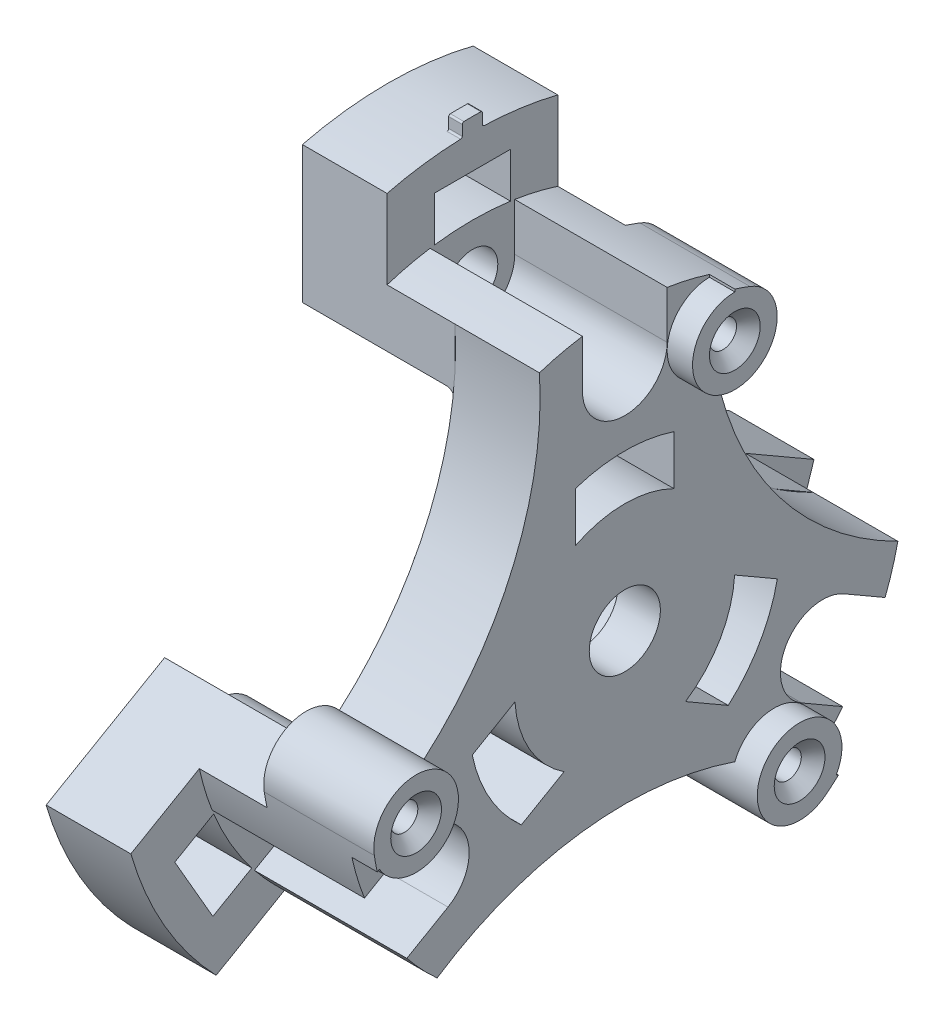
from build123d import *
from build123d.topology import SkipClean

# Parameters (mm, degrees)
SKETCH_2_R                           = 20
CUT_EXTRUDE_1_DEPTH                  = 10
PATTERN_CIRCULAR_1_COUNT             = 3
CUT_EXTRUDE_START                    = -10
CUT_EXTRUDE_2_DEPTH                  = 10
PATTERN_CIRCULAR_2_COUNT             = 3
SKETCH_4_R                           = 1.5
EXTRUDE_1_DEPTH                      = 9
PATTERN_CIRCULAR_3_COUNT             = 3
SKETCH_5_W                           = 6.1
SKETCH_5_H                           = 4.709181557
CUT_EXTRUDE_3_DEPTH                  = 1.5
CUT_EXTRUDE_3_DRAFT                  = -1
PATTERN_CIRCULAR_4_COPY_1_SKETCH_W   = 6.1
PATTERN_CIRCULAR_4_COPY_1_SKETCH_H   = 4.709181557
PATTERN_CIRCULAR_4_COPY_1_DEPTH      = 1.5
PATTERN_CIRCULAR_4_COPY_1_DRAFT      = -1
PATTERN_CIRCULAR_4_COPY_2_SKETCH_W   = 6.1
PATTERN_CIRCULAR_4_COPY_2_SKETCH_H   = 4.709181557
PATTERN_CIRCULAR_4_COPY_2_DEPTH      = 1.5
PATTERN_CIRCULAR_4_COPY_2_DRAFT      = -1
CUT_EXTRUDE_4_DEPTH                  = 9
PATTERN_CIRCULAR_5_COUNT             = 3
EXTRUDE_START                        = -6.5
EXTRUDE_2_DEPTH                      = 6.5
SKETCH_9_R                           = 0.8
CUT_EXTRUDE_7_DEPTH                  = 6.4
CHAMFER_3_SIZE                       = 0.7
PATTERN_CIRCULAR_8_COUNT             = 3
CHAMFER_3_OF_PATTERN_CIRCULAR_8_SIZE = 0.7
CHAMFER_4_SIZE                       = 0.3
FILLET_5_R                           = 0.2
FILLET_6_R                           = 0.5
FILLET_7_R                           = 0.5
EXTRUDE_START_2                      = -5
EXTRUDE_3_DEPTH                      = 5
PATTERN_CIRCULAR_9_COUNT             = 3
EXTRUDE_4_DEPTH                      = 0.8
FILLET_8_R                           = 0.1


with BuildPart() as part:
    # 草图1 → 旋转1 (revolve)
    with BuildSketch(Plane.XY, mode=Mode.PRIVATE) as revolve_1_sk:
        Polygon((-7, 6.5), (-5, 6.5), (-5, 16.5), (0, 16.5), (0, 2.1), (-2.5, 2.1), (-2.5, 4), (-7, 4), align=None)
    revolve(revolve_1_sk.sketch.rotate(Axis((-65.742857143, 0, 0), (1, 0, 0)), 90), axis=Axis((-65.742857143, 0, 0), (1, 0, 0)))

    # 草图2 → 切除-拉伸1 (cut)
    with BuildSketch(Plane.ZY.offset(5)):
        with Locations((-25, 14.43375673)):
            Circle(SKETCH_2_R)
    cut_extrude_1 = extrude(amount=-CUT_EXTRUDE_1_DEPTH, mode=Mode.SUBTRACT)

    # 阵列(圆周)1: 切除-拉伸1 ×3 about axis
    pattern_circular_1_axis = Axis((0, 0, 0), (1, 0, 0))
    for i in range(1, PATTERN_CIRCULAR_1_COUNT):
        add(cut_extrude_1.rotate(pattern_circular_1_axis, i * 360 / PATTERN_CIRCULAR_1_COUNT), mode=Mode.SUBTRACT)

    # 草图3 → 切除-拉伸2 (cut)
    with BuildSketch(Plane.ZY.offset(5).offset(CUT_EXTRUDE_START)):
        with BuildLine():
            Line((-2.9, 8.730979327), (-2.9, 5.817215829))
            ThreePointArc((-2.9, 5.817215829), (0, 6.5), (2.9, 5.817215829))
            Line((2.9, 5.817215829), (2.9, 8.730979327))
            ThreePointArc((2.9, 8.730979327), (0, 9.2), (-2.9, 8.730979327))
        make_face()
    cut_extrude_2 = extrude(amount=CUT_EXTRUDE_2_DEPTH, mode=Mode.SUBTRACT)

    # 阵列(圆周)2: 切除-拉伸2 ×3 about axis
    pattern_circular_2_axis = Axis((0, 0, 0), (1, 0, 0))
    for i in range(1, PATTERN_CIRCULAR_2_COUNT):
        add(cut_extrude_2.rotate(pattern_circular_2_axis, i * 360 / PATTERN_CIRCULAR_2_COUNT), mode=Mode.SUBTRACT)

    # 草图4 → 凸台-拉伸1 (add)
    with BuildSketch(Plane.ZY.offset(5)):
        with BuildLine():
            Line((-5.040834524, 15.711142139), (-5.040834524, 12.307720638))
            ThreePointArc((-5.040834524, 12.307720638), (-3.914741623, 12.710814216), (-2.756988875, 13.011111111))
            ThreePointArc((-2.756988875, 13.011111111), (0, 10.7), (2.756988875, 13.011111111))
            ThreePointArc((2.756988875, 13.011111111), (3.914741623, 12.710814216), (5.040834524, 12.307720638))
            Line((5.040834524, 12.307720638), (5.040834524, 15.711142139))
            ThreePointArc((5.040834524, 15.711142139), (0, 16.5), (-5.040834524, 15.711142139))
        make_face()
        with Locations((0, 13.5)):
            Circle(SKETCH_4_R, mode=Mode.SUBTRACT)
    extrude_1 = extrude(amount=EXTRUDE_1_DEPTH)

    # 阵列(圆周)3: 凸台-拉伸1 ×3 about axis
    pattern_circular_3_axis = Axis((0, 0, 0), (1, 0, 0))
    for i in range(1, PATTERN_CIRCULAR_3_COUNT):
        add(extrude_1.rotate(pattern_circular_3_axis, i * 360 / PATTERN_CIRCULAR_3_COUNT))


with BuildPart() as cut_extrude_3_tool:
    # 草图5 → 切除-拉伸3 (with draft: the straight prism first)
    with BuildSketch(Plane.ZY.offset(14)):
        with Locations((0, 11.645409221)):
            Rectangle(SKETCH_5_W, SKETCH_5_H)
    extrude(amount=-CUT_EXTRUDE_3_DEPTH)
    # 切除-拉伸3: the draft: its side faces are tilted about the plane it starts from
    cut_extrude_3_sides = [cut_extrude_3_tool.faces().sort_by_distance(p)[0] for p in [
        (-13.25, 11.645409222, -3.05),
        (-13.25, 9.290818443, 0),
        (-13.25, 11.645409222, 3.05),
        (-13.25, 14, 0),
    ]]
    draft(cut_extrude_3_sides, Plane.ZY.offset(14), CUT_EXTRUDE_3_DRAFT)


with BuildPart() as part_1:
    add(part.part)

    # 切除-拉伸3: cut by cut_extrude_3_tool
    add(cut_extrude_3_tool.part, mode=Mode.SUBTRACT)


with BuildPart() as pattern_circular_4_copy_1_tool:
    # 阵列(圆周)4 copy 1 sketch → 阵列(圆周)4 copy 1 (with draft: the straight prism first)
    with BuildSketch(Plane(origin=(-14, 0, 0), x_dir=(0, -0.8660254037844387, -0.4999999999999998), z_dir=(-1, 0, 0))):
        with Locations((0, 11.645409221)):
            Rectangle(PATTERN_CIRCULAR_4_COPY_1_SKETCH_W, PATTERN_CIRCULAR_4_COPY_1_SKETCH_H)
    extrude(amount=-PATTERN_CIRCULAR_4_COPY_1_DEPTH)
    # 阵列(圆周)4 copy 1: the draft: its side faces are tilted about the plane it starts from
    pattern_circular_4_copy_1_sides = [pattern_circular_4_copy_1_tool.faces().sort_by_distance(p)[0] for p in [
        (-13.25, -3.181327129, 11.610220224),
        (-13.25, -4.645409221, 8.046084794),
        (-13.25, -8.464082093, 8.560220224),
        (-13.25, -7, 12.124355653),
    ]]
    draft(pattern_circular_4_copy_1_sides, Plane(origin=(-14, 0, 0), x_dir=(0, -0.8660254037844387, -0.4999999999999998), z_dir=(-1, 0, 0)), PATTERN_CIRCULAR_4_COPY_1_DRAFT)


with BuildPart() as part_2:
    add(part_1.part)

    # 阵列(圆周)4 copy 1: cut by pattern_circular_4_copy_1_tool
    add(pattern_circular_4_copy_1_tool.part, mode=Mode.SUBTRACT)


with BuildPart() as pattern_circular_4_copy_2_tool:
    # 阵列(圆周)4 copy 2 sketch → 阵列(圆周)4 copy 2 (with draft: the straight prism first)
    with BuildSketch(Plane(origin=(-14, 0, 0), x_dir=(0, 0.8660254037844384, -0.5000000000000004), z_dir=(-1, 0, 0))):
        with Locations((0, 11.645409221)):
            Rectangle(PATTERN_CIRCULAR_4_COPY_2_SKETCH_W, PATTERN_CIRCULAR_4_COPY_2_SKETCH_H)
    extrude(amount=-PATTERN_CIRCULAR_4_COPY_2_DEPTH)
    # 阵列(圆周)4 copy 2: the draft: its side faces are tilted about the plane it starts from
    pattern_circular_4_copy_2_sides = [pattern_circular_4_copy_2_tool.faces().sort_by_distance(p)[0] for p in [
        (-13.25, -8.464082093, -8.560220224),
        (-13.25, -4.645409222, -8.046084794),
        (-13.25, -3.181327129, -11.610220224),
        (-13.25, -7, -12.124355653),
    ]]
    draft(pattern_circular_4_copy_2_sides, Plane(origin=(-14, 0, 0), x_dir=(0, 0.8660254037844384, -0.5000000000000004), z_dir=(-1, 0, 0)), PATTERN_CIRCULAR_4_COPY_2_DRAFT)


with BuildPart() as part_3:
    add(part_2.part)

    # 阵列(圆周)4 copy 2: cut by pattern_circular_4_copy_2_tool
    add(pattern_circular_4_copy_2_tool.part, mode=Mode.SUBTRACT)

    # 草图6 → 切除-拉伸4 (cut)
    with BuildSketch(Plane(origin=(0, 0, 0), x_dir=(0, 0, -1), z_dir=(1, 0, 0))):
        with BuildLine():
            Line((-2.5, 16.30950643), (-2.5, 13.5))
            ThreePointArc((-2.5, 13.5), (0, 11), (2.5, 13.5))
            Line((2.5, 13.5), (2.5, 16.30950643))
            ThreePointArc((2.5, 16.30950643), (0, 16.5), (-2.5, 16.30950643))
        make_face()
    cut_extrude_4 = extrude(amount=-CUT_EXTRUDE_4_DEPTH, mode=Mode.SUBTRACT)

    # 阵列(圆周)5: 切除-拉伸4 ×3 about axis
    pattern_circular_5_axis = Axis((0, 0, 0), (1, 0, 0))
    for i in range(1, PATTERN_CIRCULAR_5_COUNT):
        add(cut_extrude_4.rotate(pattern_circular_5_axis, i * 360 / PATTERN_CIRCULAR_5_COUNT), mode=Mode.SUBTRACT)

    # 草图7 → 凸台-拉伸2 (add)
    with BuildSketch(Plane.ZY.offset(5).offset(EXTRUDE_START)):
        with BuildLine():
            Line((-5, 15.576696831), (-5, 15.724185194))
            ThreePointArc((-5, 15.724185194), (-5.448667451, 15.574402814), (-5.892857143, 15.411821265))
            ThreePointArc((-5.892857143, 15.411821265), (-4.546023726, 10.618261242), (-5, 15.576696831))
        make_face()
    extrude_2 = extrude(amount=EXTRUDE_2_DEPTH)

    # 草图9 → 切除-拉伸7 (cut)
    with SkipClean():  # the faces are left unmerged after this step: merging them gives an invalid solid
        with BuildSketch(Plane(origin=(1.5, 0, 0), x_dir=(0, 0, -1), z_dir=(1, 0, 0))):
            with Locations((5, 13.076696831)):
                Circle(SKETCH_9_R)
        cut_extrude_7 = extrude(amount=-CUT_EXTRUDE_7_DEPTH, mode=Mode.SUBTRACT)

    # 倒角3
    chamfer_3_edges = [part_3.edges().sort_by_distance(p)[0] for p in [
        (1.5, 13.076696831, -4.2),
    ]]
    chamfer(chamfer_3_edges, length=CHAMFER_3_SIZE)

    # 阵列(圆周)8: 凸台-拉伸2, 切除-拉伸7 ×3 about axis
    with SkipClean():  # the faces are left unmerged after this step: merging them gives an invalid solid
        pattern_circular_8_axis = Axis((0, 0, 0), (1, 0, 0))
        add([extrude_2.rotate(pattern_circular_8_axis, i * 360 / PATTERN_CIRCULAR_8_COUNT) for i in range(1, PATTERN_CIRCULAR_8_COUNT)])
        add([cut_extrude_7.rotate(pattern_circular_8_axis, i * 360 / PATTERN_CIRCULAR_8_COUNT) for i in range(1, PATTERN_CIRCULAR_8_COUNT)], mode=Mode.SUBTRACT)

    # 倒角3 of 阵列(圆周)8
    chamfer_3_of_pattern_circular_8_edges = [part_3.edges().sort_by_distance(p)[0] for p in [
        (1.5, -2.901041719, 13.424751653),
        (1.5, -10.175655111, -9.224751653),
    ]]
    chamfer(chamfer_3_of_pattern_circular_8_edges, length=CHAMFER_3_OF_PATTERN_CIRCULAR_8_SIZE)

    # 倒角4
    chamfer_4_edges = [part_3.edges().sort_by_distance(p)[0] for p in [
        (-7, 0, -4),
    ]]
    chamfer(chamfer_4_edges, length=CHAMFER_4_SIZE)

    # 圆角5
    fillet_5_edges = [part_3.edges().sort_by_distance(p)[0] for p in [
        (-13.250000029, 12.948636435, 3.036908702),
        (-13.250000029, 12.948636435, -3.036908702),
        (-13.250000029, -9.104358302, 9.695393747),
        (-13.250000029, -3.844278133, 12.732302448),
        (-13.250000029, -3.844278133, -12.732302448),
        (-13.250000029, -9.104358302, -9.695393747),
    ]]
    fillet(fillet_5_edges, radius=FILLET_5_R)

    # 圆角6
    # the kernel refuses this fillet: 0.5 mm, written as the material it adds along each edge
    with BuildSketch(Plane(origin=(-5, 0, 0), x_dir=(0, 0.8857393976265326, -0.464182851355139), z_dir=(0, -0.464182851355139, -0.8857393976265326))) as fillet_6_piece_1_section:
        with BuildLine():
            CenterArc((13.3 - FILLET_6_R, -FILLET_6_R), FILLET_6_R, 0, 90)
            Line((13.3, -FILLET_6_R), (13.3, 0))
            Line((13.3, 0), (13.3 - FILLET_6_R, 0))
        make_face()
    fillet_6_piece_1 = revolve(axis=Axis((-5, 0, 0), (1, 0, 0)), revolution_arc=21.078593678, mode=Mode.PRIVATE)
    fillet_6_piece_1 = split(fillet_6_piece_1, bisect_by=Plane(origin=(-5.11248896, 12.576915206, -5.040834524), z_dir=(0, 0, 1)), keep=Keep.TOP, mode=Mode.PRIVATE)
    fillet_6_piece_1 = fillet_6_piece_1 - Plane(origin=(-5.11248896, 13.5, 0), x_dir=(0, -0.17460317460317398, -0.9846388837632271), z_dir=(1, 0, 0)) * Cylinder(2.8, 54, mode=Mode.PRIVATE)
    add(fillet_6_piece_1)
    with BuildSketch(Plane(origin=(-5, 13.5, 0), x_dir=(0, 0.26816925317072343, 0.9633718138153392), z_dir=(0, 0.9633718138153392, -0.26816925317072343))) as fillet_6_piece_2:
        with BuildLine():
            CenterArc((2.8 + FILLET_6_R, -FILLET_6_R), FILLET_6_R, 90, 90)
            Line((2.8, -FILLET_6_R), (2.8, 0))
            Line((2.8, 0), (2.8 + FILLET_6_R, 0))
        make_face()
    revolve(axis=Axis((-5, 13.5, 0), (1, 0, 0)), revolution_arc=211.110711493)
    with BuildSketch(Plane(origin=(-5, 0, 0), x_dir=(0, 0.9934153120018582, 0.11456883468138611), z_dir=(0, 0.11456883468138611, -0.9934153120018582))) as fillet_6_piece_3_section:
        with BuildLine():
            CenterArc((13.3 - FILLET_6_R, -FILLET_6_R), FILLET_6_R, 0, 90)
            Line((13.3, -FILLET_6_R), (13.3, 0))
            Line((13.3, 0), (13.3 - FILLET_6_R, 0))
        make_face()
    fillet_6_piece_3 = revolve(axis=Axis((-5, 0, 0), (1, 0, 0)), revolution_arc=21.078593678, mode=Mode.PRIVATE)
    fillet_6_piece_3 = split(fillet_6_piece_3, bisect_by=Plane(origin=(-5.112488964, 12.576915331, 5.040834524), z_dir=(0, 0, -1)), keep=Keep.TOP, mode=Mode.PRIVATE)
    fillet_6_piece_3 = fillet_6_piece_3 - Plane(origin=(-5.112488964, 13.5, 0), x_dir=(0, -0.17460317460317398, -0.9846388837632271), z_dir=(1, 0, 0)) * Cylinder(2.8, 54, mode=Mode.PRIVATE)
    add(fillet_6_piece_3)
    with BuildSketch(Plane(origin=(-5, 0, 0), x_dir=(0, -0.844863840087913, -0.5349813937997333), z_dir=(0, -0.5349813937997333, 0.844863840087913))) as fillet_6_piece_4_section:
        with BuildLine():
            CenterArc((13.3 - FILLET_6_R, -FILLET_6_R), FILLET_6_R, 0, 90)
            Line((13.3, -FILLET_6_R), (13.3, 0))
            Line((13.3, 0), (13.3 - FILLET_6_R, 0))
        make_face()
    fillet_6_piece_4 = revolve(axis=Axis((-5, 0, 0), (1, 0, 0)), revolution_arc=21.078593678, mode=Mode.PRIVATE)
    fillet_6_piece_4 = split(fillet_6_piece_4, bisect_by=Plane(origin=(-5.11248896, -10.653948357, -8.371510808), z_dir=(0, 0.8660254037844384, -0.5000000000000004)), keep=Keep.TOP, mode=Mode.PRIVATE)
    fillet_6_piece_4 = fillet_6_piece_4 - Plane(origin=(-5.11248896, -6.75, -11.691342951), x_dir=(0, -0.7654206995913203, 0.6435302266693725), z_dir=(1, 0, 0)) * Cylinder(2.8, 54, mode=Mode.PRIVATE)
    add(fillet_6_piece_4)
    with BuildSketch(Plane(origin=(-5, -6.75, -11.691342951), x_dir=(0, 0.7002198374686142, -0.713927292667417), z_dir=(0, -0.713927292667417, -0.7002198374686142))) as fillet_6_piece_5:
        with BuildLine():
            CenterArc((2.8 + FILLET_6_R, -FILLET_6_R), FILLET_6_R, 90, 90)
            Line((2.8, -FILLET_6_R), (2.8, 0))
            Line((2.8, 0), (2.8 + FILLET_6_R, 0))
        make_face()
    revolve(axis=Axis((-5, -6.75, -11.691342951), (1, 0, 0)), revolution_arc=211.110711493)
    with BuildSketch(Plane(origin=(-5, 0, 0), x_dir=(0, -0.39748813468486965, -0.9176073140427462), z_dir=(0, -0.9176073140427462, 0.39748813468486965))) as fillet_6_piece_6_section:
        with BuildLine():
            CenterArc((13.3 - FILLET_6_R, -FILLET_6_R), FILLET_6_R, 0, 90)
            Line((13.3, -FILLET_6_R), (13.3, 0))
            Line((13.3, 0), (13.3 - FILLET_6_R, 0))
        make_face()
    fillet_6_piece_6 = revolve(axis=Axis((-5, 0, 0), (1, 0, 0)), revolution_arc=21.078593678, mode=Mode.PRIVATE)
    fillet_6_piece_6 = split(fillet_6_piece_6, bisect_by=Plane(origin=(-5.112488964, -1.922966912, -13.412345439), z_dir=(0, -0.8660254037844384, 0.5000000000000004)), keep=Keep.TOP, mode=Mode.PRIVATE)
    fillet_6_piece_6 = fillet_6_piece_6 - Plane(origin=(-5.112488964, -6.75, -11.691342951), x_dir=(0, -0.7654206995913203, 0.6435302266693725), z_dir=(1, 0, 0)) * Cylinder(2.8, 54, mode=Mode.PRIVATE)
    add(fillet_6_piece_6)
    with BuildSketch(Plane(origin=(-5, 0, 0), x_dir=(0, -0.040875557538619156, 0.9991642451548729), z_dir=(0, 0.9991642451548729, 0.040875557538619156))) as fillet_6_piece_7_section:
        with BuildLine():
            CenterArc((13.3 - FILLET_6_R, -FILLET_6_R), FILLET_6_R, 0, 90)
            Line((13.3, -FILLET_6_R), (13.3, 0))
            Line((13.3, 0), (13.3 - FILLET_6_R, 0))
        make_face()
    fillet_6_piece_7 = revolve(axis=Axis((-5, 0, 0), (1, 0, 0)), revolution_arc=21.078593678, mode=Mode.PRIVATE)
    fillet_6_piece_7 = split(fillet_6_piece_7, bisect_by=Plane(origin=(-5.11248896, -1.922966849, 13.412345331), z_dir=(0, -0.8660254037844388, -0.49999999999999983)), keep=Keep.TOP, mode=Mode.PRIVATE)
    fillet_6_piece_7 = fillet_6_piece_7 - Plane(origin=(-5.11248896, -6.75, 11.691342951), x_dir=(0, 0.9400238741944947, 0.34110865709385474), z_dir=(1, 0, 0)) * Cylinder(2.8, 54, mode=Mode.PRIVATE)
    add(fillet_6_piece_7)
    with BuildSketch(Plane(origin=(-5, -6.75, 11.691342951), x_dir=(0, -0.9683890906393379, -0.24944452114792226), z_dir=(0, -0.24944452114792226, 0.9683890906393379))) as fillet_6_piece_8:
        with BuildLine():
            CenterArc((2.8 + FILLET_6_R, -FILLET_6_R), FILLET_6_R, 90, 90)
            Line((2.8, -FILLET_6_R), (2.8, 0))
            Line((2.8, 0), (2.8 + FILLET_6_R, 0))
        make_face()
    revolve(axis=Axis((-5, -6.75, 11.691342951), (1, 0, 0)), revolution_arc=211.110711493)
    with BuildSketch(Plane(origin=(-5, 0, 0), x_dir=(0, -0.5959271773169883, 0.8030384793613609), z_dir=(0, 0.8030384793613609, 0.5959271773169883))) as fillet_6_piece_9_section:
        with BuildLine():
            CenterArc((13.3 - FILLET_6_R, -FILLET_6_R), FILLET_6_R, 0, 90)
            Line((13.3 - FILLET_6_R, 0), (13.3, 0))
            Line((13.3, 0), (13.3, -FILLET_6_R))
        make_face()
    fillet_6_piece_9 = revolve(axis=Axis((-5, 0, 0), (1, 0, 0)), revolution_arc=21.078593678, mode=Mode.PRIVATE)
    fillet_6_piece_9 = split(fillet_6_piece_9, bisect_by=Plane(origin=(-5.112488962, -10.653948418, 8.371510914), z_dir=(0, 0.8660254037844388, 0.49999999999999983)), keep=Keep.TOP, mode=Mode.PRIVATE)
    fillet_6_piece_9 = fillet_6_piece_9 - Plane(origin=(-5.112488962, -6.75, 11.691342951), x_dir=(0, 0.9400238741944947, 0.34110865709385474), z_dir=(1, 0, 0)) * Cylinder(2.8, 54, mode=Mode.PRIVATE)
    add(fillet_6_piece_9)

    # 圆角7
    fillet_7_edges = [part_3.edges().sort_by_distance(p)[0] for p in [
        (-7, 0, -6.5),
    ]]
    fillet(fillet_7_edges, radius=FILLET_7_R)

    # 草图11 → 凸台-拉伸3 (add)
    with BuildSketch(Plane.ZY.offset(14).offset(EXTRUDE_START_2)):
        with BuildLine():
            Line((-5.040834524, 15.711142139), (-5.040834524, 20.386024313))
            ThreePointArc((-5.040834524, 20.386024313), (-2.539044054, 20.845940979), (0, 21))
            ThreePointArc((0, 21), (2.539044054, 20.845940979), (5.040834524, 20.386024313))
            Line((5.040834524, 20.386024313), (5.040834524, 15.711142139))
            ThreePointArc((5.040834524, 15.711142139), (3.659205816, 16.089133376), (2.25, 16.345871038))
            Line((2.25, 16.345871038), (2.25, 19))
            Line((2.25, 19), (-2.25, 19))
            Line((-2.25, 19), (-2.25, 16.345871038))
            ThreePointArc((-2.25, 16.345871038), (-3.659205816, 16.089133376), (-5.040834524, 15.711142139))
        make_face()
    extrude_3 = extrude(amount=EXTRUDE_3_DEPTH)

    # 阵列(圆周)9: 凸台-拉伸3 ×3 about axis
    pattern_circular_9_axis = Axis((0, 0, 0), (1, 0, 0))
    for i in range(1, PATTERN_CIRCULAR_9_COUNT):
        add(extrude_3.rotate(pattern_circular_9_axis, i * 360 / PATTERN_CIRCULAR_9_COUNT))

    # 草图12 → 凸台-拉伸4 (add)
    with BuildSketch(Plane(origin=(-9, 0, 0), x_dir=(0, 0, -1), z_dir=(1, 0, 0))):
        with BuildLine():
            Line((-0.6, 21.791741555), (-0.6, 20.991426821))
            ThreePointArc((-0.6, 20.991426821), (0, 21), (0.6, 20.991426821))
            Line((0.6, 20.991426821), (0.6, 21.791741555))
            ThreePointArc((0.6, 21.791741555), (0, 21.8), (-0.6, 21.791741555))
        make_face()
    extrude(amount=-EXTRUDE_4_DEPTH)

    # 圆角8
    # the kernel refuses this fillet: 0.1 mm, written as the material it adds along each edge
    with BuildSketch(Plane(origin=(-9, 20.991426821, -0.6), x_dir=(0, -0.030873473888862513, -0.9995233006838978), z_dir=(-1, 0, 0))) as fillet_8_piece_1:
        with BuildLine():
            CenterArc((0.096958881, -0.099999735), FILLET_8_R, 90.13195581, 88.098843303)
            Line((-0.002993449, -0.096912387), (0, 0))
            ThreePointArc((0, 0), (0.048364287, -5.5693e-05), (0.096728575, 0))
        make_face()
    extrude(amount=0.8)
    with BuildSketch(Plane(origin=(-9, 20.991426821, 0.6), x_dir=(0, -0.030873473888825786, 0.9995233006838989), z_dir=(-1, 0, 0))) as fillet_8_piece_2:
        with BuildLine():
            CenterArc((0.096958881, 0.099999735), FILLET_8_R, 181.769200887, 88.098843303)
            Line((-0.002993449, 0.096912387), (0, 0))
            ThreePointArc((0, 0), (0.048364287, 5.5693e-05), (0.096728575, 0))
        make_face()
    extrude(amount=0.8)
    # the kernel refuses this fillet: 0.1 mm, written as the material it takes off along each edge
    with BuildSketch(Plane(origin=(-8.755682273, 21.791741555, -0.6), x_dir=(0, -1, 0), z_dir=(-1, 0, 0))) as fillet_8_2_piece_1:
        with BuildLine():
            CenterArc((0.097502688, 0.1), FILLET_8_R, 181.320296095, 88.679703905)
            ThreePointArc((-0.002470763, 0.097695853), (-0.001290126, 0.048846542), (0, 0))
            Line((0, 0), (0.097502688, 0))
        make_face()
    extrude(amount=1.288635454, mode=Mode.SUBTRACT)
    with BuildSketch(Plane(origin=(-8.755682273, 21.791741555, 0.6), x_dir=(0, 0.025282268727276208, -0.999680352356693), z_dir=(-1, 0, 0))) as fillet_8_2_piece_2:
        with BuildLine():
            CenterArc((0.097502946, 0.099999749), FILLET_8_R, 181.448721658, 88.679703905)
            Line((-0.002465089, 0.097471522), (0, 0))
            ThreePointArc((0, 0), (0.048863545, -5.4763e-05), (0.097727091, 0))
        make_face()
    extrude(amount=1.288635454, mode=Mode.SUBTRACT)


solid = part_3.part
